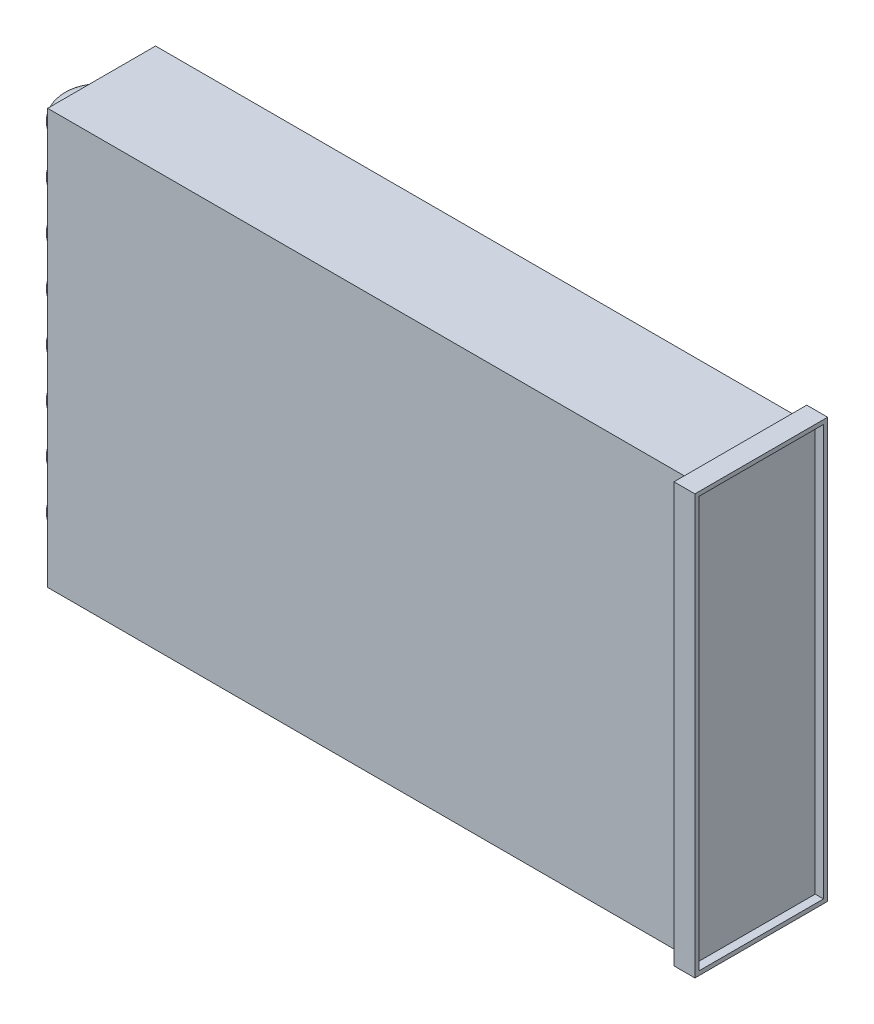
from build123d import *

# Parameters (mm, degrees)
SKETCH1_W           = 244.375
SKETCH1_H           = 158.75
BOSS_EXTRUDE1_DEPTH = 20.6375
SKETCH4_W           = 50.8
SKETCH4_H           = 160.4
BOSS_EXTRUDE2_DEPTH = 8.001
SWEEP1_OUTLINE_R    = 4.05
SKETCH5_W           = 47.625
SKETCH5_H           = 157.225
CUT_EXTRUDE1_DEPTH  = 3.175
LPATTERN1_COUNT     = 8
LPATTERN1_PITCH     = 18.5


# Read off the part's stored shape, not the designer's step: Sweep1
with BuildPart() as part:
    # Sketch1 → Boss-Extrude1 (new, symmetric)
    with BuildSketch(Plane.XY):
        Rectangle(SKETCH1_W, SKETCH1_H)
    extrude(amount=BOSS_EXTRUDE1_DEPTH, both=True)

    # Sketch4 → Boss-Extrude2 (add)
    with BuildSketch(Plane(origin=(122.1875, 0, 0), x_dir=(0, 0, -1), z_dir=(1, 0, 0))):
        Rectangle(SKETCH4_W, SKETCH4_H)
    extrude(amount=BOSS_EXTRUDE2_DEPTH)

    # Sweep1 outline → Sweep1 (revolve)
    with BuildSketch(Plane(origin=(-122.1875, 0, 0.3625), x_dir=(1, 0, 0), z_dir=(0, 0, 1))):
        with Locations((10.675, 64.925)):
            Circle(SWEEP1_OUTLINE_R)
    sweep1 = revolve(axis=Axis((-122.1875, 0, 0.3625), (0, 1, 0)))

    # Sketch5 → Cut-Extrude1 (cut)
    with BuildSketch(Plane(origin=(130.1885, 0, 0), x_dir=(0, 0, -1), z_dir=(1, 0, 0))):
        Rectangle(SKETCH5_W, SKETCH5_H)
    extrude(amount=-CUT_EXTRUDE1_DEPTH, mode=Mode.SUBTRACT)

    # LPattern1: Sweep1 ×8
    with Locations(*[(0, -i * LPATTERN1_PITCH, 0) for i in range(1, LPATTERN1_COUNT)]):
        add(sweep1)


solid = part.part
